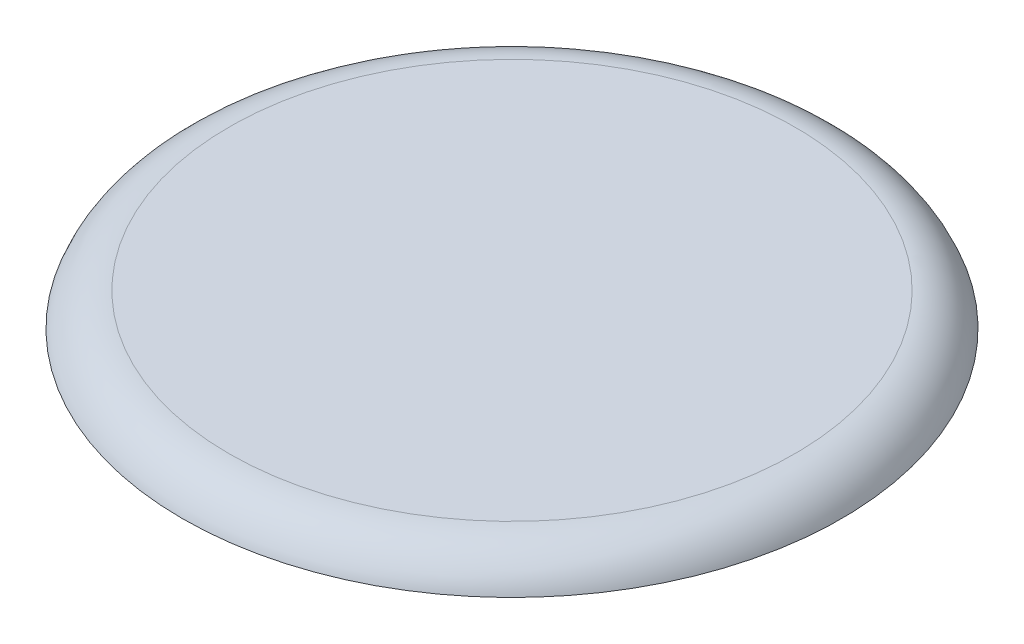
from build123d import *

# Parameters (mm, degrees)
SKETCH2_R           = 127
BOSS_EXTRUDE1_DEPTH = 12.7
FILLET1_R           = 19.05
SKETCH3_R           = 111.125
CUT_EXTRUDE1_DEPTH  = 2.54


with BuildPart() as part:
    # Sketch2 → Boss-Extrude1 (new body)
    with BuildSketch(Plane(origin=(0, 0, 0), x_dir=(1, 0, 0), z_dir=(0, 1, 0))):
        with Locations(Location((0, 0, 0), (0, 0, 270))):
            Circle(SKETCH2_R)
    extrude(amount=BOSS_EXTRUDE1_DEPTH)

    # Fillet1
    # the kernel refuses this fillet: 19.05 mm, written as the material it takes off along each edge
    with BuildSketch(Plane(origin=(0, 12.7, 0), x_dir=(0, 0, 1), z_dir=(-1, 0, 0))) as fillet1_piece_1:
        with BuildLine():
            CenterArc((109.039487758, -19.05), FILLET1_R, 19.471220634, 70.528779366)
            Line((109.039487758, 0), (109.039487758, 0.381))
            Line((109.039487758, 0.381), (127, 0.381))
            Line((127, 0.381), (127.381, 0))
            ThreePointArc((127.381, 0), (127.381, -6.35), (127.359210245, -12.573))
            Line((127.359210245, -12.573), (127, -12.7))
        make_face()
    revolve(axis=Axis((0, 12.7, 0), (0, 1, 0)), mode=Mode.SUBTRACT)

    # Sketch3 → Cut-Extrude1 (cut)
    with BuildSketch(Plane.XZ):
        with Locations(Location((0, 0, 0), (0, 0, 270))):
            Circle(SKETCH3_R)
    extrude(amount=-CUT_EXTRUDE1_DEPTH, mode=Mode.SUBTRACT)


solid = part.part
